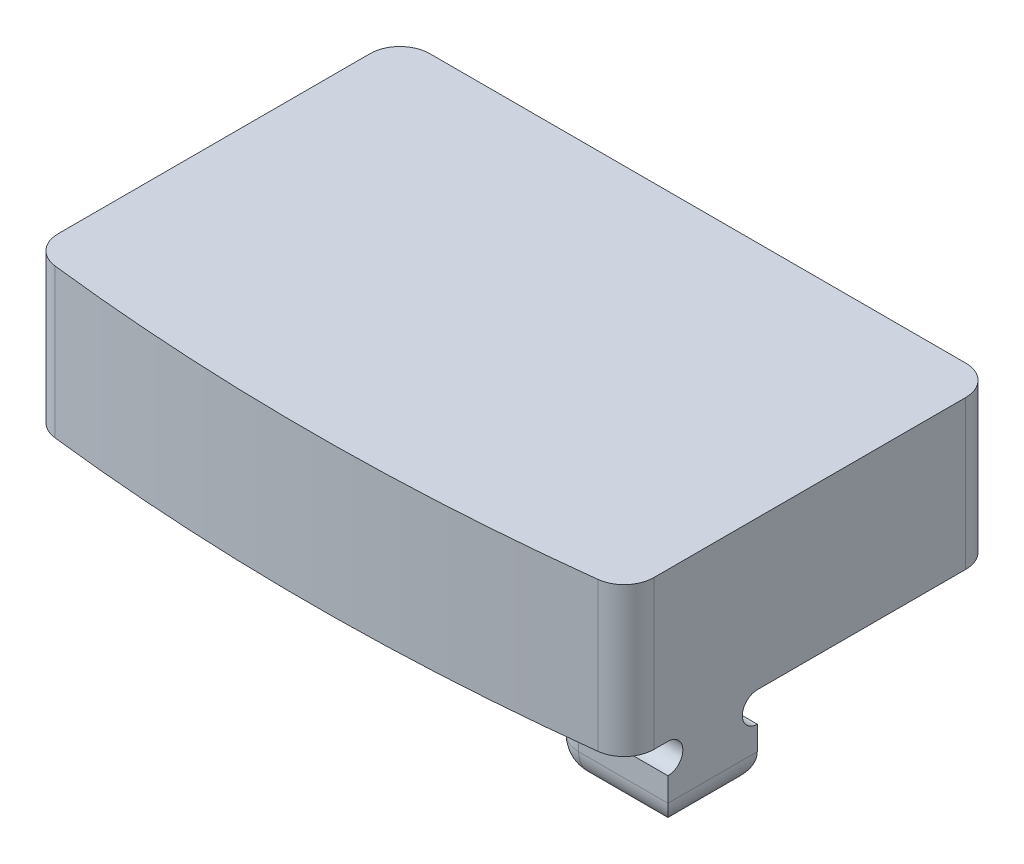
from build123d import *

# Parameters (mm, degrees)
BOSS_EXTRUDE1_DEPTH = 5
FILLET1_R           = 1
SKETCH3_R           = 0.7835
CUT_EXTRUDE1_DEPTH  = 4
BOSS_EXTRUDE3_DEPTH = 4
FILLET2_R           = 1


with BuildPart() as part:
    # Sketch1 → Boss-Extrude1 (new body)
    with BuildSketch(Plane(origin=(0, 0, 0), x_dir=(1, 0, 0), z_dir=(0, 1, 0))):
        with BuildLine():
            Line((0.5, 0.643681577), (0.5, 13))
            Line((0.5, 13), (20.5, 13))
            Line((20.5, 13), (20.5, 0.643681577))
            ThreePointArc((20.5, 0.643681577), (10.5, 0), (0.5, 0.643681577))
        make_face()
    extrude(amount=BOSS_EXTRUDE1_DEPTH)

    # Fillet1
    fillet1_edges = [part.edges().sort_by_distance(p)[0] for p in [
        (20.5, 2.5, -13),
        (0.5, 2.5, -13),
        (20.5, 2.5, -0.643681577),
        (0.5, 2.5, -0.643681577),
    ]]
    fillet(fillet1_edges, radius=FILLET1_R)

    # Sketch3 → Cut-Extrude1 (cut)
    with BuildSketch(Plane.XZ):
        with Locations((5.5, -9)):
            Circle(SKETCH3_R)
        with Locations((15.5, -9)):
            Circle(SKETCH3_R)
    extrude(amount=-CUT_EXTRUDE1_DEPTH, mode=Mode.SUBTRACT)

    # Sketch5 → Boss-Extrude3 (add)
    with BuildSketch(Plane(origin=(20.5, 0, 0), x_dir=(0, 0, -1), z_dir=(1, 0, 0))):
        with BuildLine():
            Line((2, 0), (5, 0))
            ThreePointArc((5, 0), (4.5, -0.5), (5, -1))
            Line((5, -1), (5, -2.8))
            Line((5, -2.8), (2, -2.8))
            Line((2, -2.8), (2, -1))
            ThreePointArc((2, -1), (2.5, -0.5), (2, 0))
        make_face()
    extrude(amount=-BOSS_EXTRUDE3_DEPTH)

    # Fillet2
    fillet2_edges = [part.edges().sort_by_distance(p)[0] for p in [
        (18.5, -2.8, -5),
        (16.5, -2.8, -3.5),
        (18.5, -2.8, -2),
        (20.5, -2.8, -3.5),
        (16.5, -1.9, -2),
        (16.5, -1.9, -5),
    ]]
    fillet(fillet2_edges, radius=FILLET2_R)


solid = part.part
